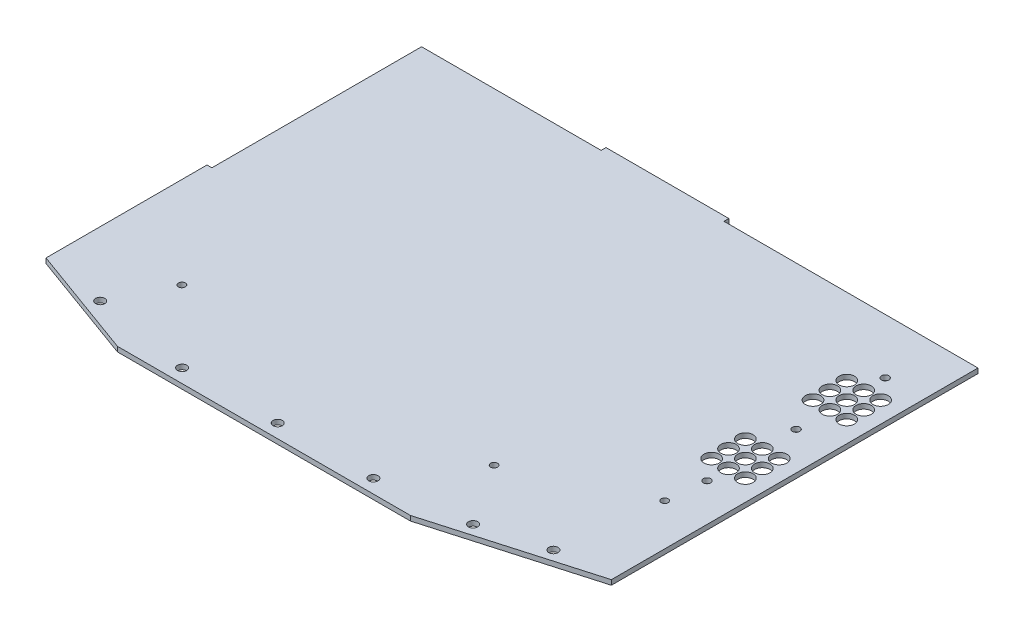
from build123d import *

# Parameters (mm, degrees)
SKETCH1_W               = 308.1112
SKETCH1_H               = 3.175
BOSS_EXTRUDE1_DEPTH     = 267.83
SKETCH3_W               = 267.83
SKETCH3_H               = 3.175
BOSS_EXTRUDE3_DEPTH     = 3.175
SKETCH4_W               = 50.87366
SKETCH4_H               = 3.175
BOSS_EXTRUDE4_DEPTH     = 267.83
CUT_EXTRUDE1_DEPTH      = 340.190761306
CUT_EXTRUDE3_DEPTH      = 340.190761306
SKETCH17_W              = 105.930619964
SKETCH17_H              = 3.175
BOSS_EXTRUDE5_DEPTH     = 3.175
CUT_EXTRUDE7_DEPTH      = 340.190761306
CUT_EXTRUDE7_DEPTH_BACK = 340.190761306
SKETCH25_R              = 3
CUT_EXTRUDE8_DEPTH      = 3.175
SKETCH27_R              = 5
CUT_EXTRUDE9_DEPTH      = 340.190761306
M4_CLEARANCE_HOLE1_D    = 4.5
SKETCH30_W              = 80
SKETCH30_H              = 3.175
BOSS_EXTRUDE6_DEPTH     = 3.175
SKETCH31_R              = 2.4
CUT_EXTRUDE10_DEPTH     = 340.190761306
LPATTERN1_COUNT         = 3
LPATTERN1_PITCH         = 58


with BuildPart() as part:
    # Sketch1 → Boss-Extrude1 (new body)
    with BuildSketch(Plane.XY):
        Rectangle(SKETCH1_W, SKETCH1_H)
    extrude(amount=BOSS_EXTRUDE1_DEPTH)

    # Sketch3 → Boss-Extrude3 (add)
    with BuildSketch(Plane(origin=(154.0556, 0, 0), x_dir=(0, 0, -1), z_dir=(1, 0, 0))):
        with Locations((-133.915, 0)):
            Rectangle(SKETCH3_W, SKETCH3_H)
    extrude(amount=BOSS_EXTRUDE3_DEPTH)

    # Sketch4 → Boss-Extrude4 (add)
    with BuildSketch(Plane.XY.offset(267.83)):
        with Locations((182.66743, 0)):
            Rectangle(SKETCH4_W, SKETCH4_H)
    extrude(amount=-BOSS_EXTRUDE4_DEPTH)

    # Sketch6 → Cut-Extrude1 (cut, through all)
    with BuildSketch(Plane(origin=(0, 1.5875, 0), x_dir=(1, 0, 0), z_dir=(0, 1, 0))):
        Polygon((208.10426, -238.620139294), (106.50426, -267.83), (208.10426, -267.83), align=None)
    extrude(amount=-CUT_EXTRUDE1_DEPTH, mode=Mode.SUBTRACT)

    # Sketch11 → Cut-Extrude3 (cut, through all)
    with BuildSketch(Plane.XZ.offset(1.5875)):
        Polygon((-154.0556, 242.43), (-84.2056, 267.83), (-154.0556, 267.83), align=None)
    extrude(amount=-CUT_EXTRUDE3_DEPTH, mode=Mode.SUBTRACT)

    # Sketch17 → Boss-Extrude5 (add)
    with BuildSketch(Plane.ZY.offset(154.0556)):
        with Locations((189.464690018, 0)):
            Rectangle(SKETCH17_W, SKETCH17_H)
    extrude(amount=BOSS_EXTRUDE5_DEPTH)

    # Sketch23 → Cut-Extrude7 (cut, two sides: drawn at the far end of the back side and taken through both)
    with BuildSketch(Plane(origin=(0, 1.5875, 0), x_dir=(1, 0, 0), z_dir=(0, 1, 0)).offset(-CUT_EXTRUDE7_DEPTH_BACK)):
        Polygon((678.256720653, -545.089025692), (-154.0556, -242.43), (-157.2306, -241.275454545), (-989.542920653, 61.383571147), (-1594.860972038, -1603.24107016), (72.938669269, -2209.713666999), align=None)
    extrude(amount=CUT_EXTRUDE7_DEPTH + CUT_EXTRUDE7_DEPTH_BACK, mode=Mode.SUBTRACT)

    # Sketch25 → Cut-Extrude8 (cut)
    with BuildSketch(Plane.XZ.offset(1.5875)):
        with Locations((-115.3206, 247.915394364)):
            Circle(SKETCH25_R)
        with Locations((-50.97574, 258.94)):
            Circle(SKETCH25_R)
        with Locations((11.25426, 258.94)):
            Circle(SKETCH25_R)
        with Locations((73.48426, 258.94)):
            Circle(SKETCH25_R)
        with Locations((172.54426, 240.761310541)):
            Circle(SKETCH25_R)
        with Locations((131.90426, 252.445254824)):
            Circle(SKETCH25_R)
    extrude(amount=-CUT_EXTRUDE8_DEPTH, mode=Mode.SUBTRACT)

    # Sketch27 → Cut-Extrude9 (cut, through all)
    with BuildSketch(Plane.XZ.offset(1.5875)):
        with Locations((172.48674, 137.774823778)):
            Circle(SKETCH27_R)
        with Locations((183.48674, 137.774823778)):
            Circle(SKETCH27_R)
        with Locations((194.48674, 137.774823778)):
            Circle(SKETCH27_R)
        with Locations((194.48674, 126.774823778)):
            Circle(SKETCH27_R)
        with Locations((194.48674, 115.774823778)):
            Circle(SKETCH27_R)
        with Locations((183.48674, 126.774823778)):
            Circle(SKETCH27_R)
        with Locations((183.48674, 115.774823778)):
            Circle(SKETCH27_R)
        with Locations((172.48674, 115.774823778)):
            Circle(SKETCH27_R)
        with Locations((172.48674, 126.774823778)):
            Circle(SKETCH27_R)
        with Locations((194.48674, 71.774823778)):
            Circle(SKETCH27_R)
        with Locations((194.48674, 60.774823778)):
            Circle(SKETCH27_R)
        with Locations((194.48674, 49.774823778)):
            Circle(SKETCH27_R)
        with Locations((183.48674, 71.774823778)):
            Circle(SKETCH27_R)
        with Locations((183.48674, 60.774823778)):
            Circle(SKETCH27_R)
        with Locations((183.48674, 49.774823778)):
            Circle(SKETCH27_R)
        with Locations((172.48674, 49.774823778)):
            Circle(SKETCH27_R)
        with Locations((172.48674, 60.774823778)):
            Circle(SKETCH27_R)
        with Locations((172.48674, 71.774823778)):
            Circle(SKETCH27_R)
    extrude(amount=-CUT_EXTRUDE9_DEPTH, mode=Mode.SUBTRACT)

    # M4 Clearance Hole1 (through all)
    with Locations(Plane.XZ.offset(1.5875)):
        with Locations((105.42905, 212.2849914), (-97.77095, 212.2849914), (180.96500002, 176.776)):
            Hole(M4_CLEARANCE_HOLE1_D / 2)

    # Sketch30 → Boss-Extrude6 (add)
    with BuildSketch(Plane(origin=(0, 0, 0), x_dir=(-1, 0, 0), z_dir=(0, 0, -1))):
        with Locations((-2.78399998, 0)):
            Rectangle(SKETCH30_W, SKETCH30_H)
    extrude(amount=BOSS_EXTRUDE6_DEPTH)

    # Sketch31 → Cut-Extrude10 (cut, symmetric)
    with BuildSketch(Plane.XZ.offset(1.5875)):
        with Locations((183.48674, 151.774823778)):
            Circle(SKETCH31_R)
    cut_extrude10 = extrude(amount=CUT_EXTRUDE10_DEPTH, both=True, mode=Mode.SUBTRACT)

    # LPattern1: Cut-Extrude10 ×3
    with Locations(*[(0, 0, -i * LPATTERN1_PITCH) for i in range(1, LPATTERN1_COUNT)]):
        add(cut_extrude10, mode=Mode.SUBTRACT)


solid = part.part
